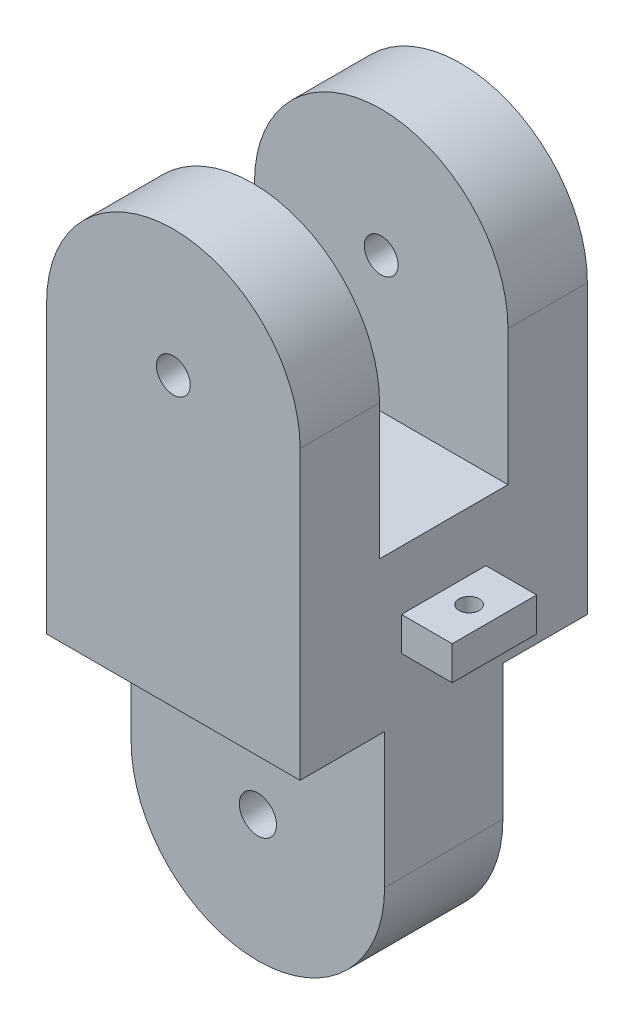
from build123d import *

# Parameters (mm, degrees)
LINK1_BODY_DEPTH       = 8.5
TONGUE_CUT_DEPTH       = 37.789944278
TONGUE_CUT_DEPTH_BACK  = 37.789944278
SKETCH1_W              = 5.5
SKETCH1_H              = 15.998130079
SLOT_CUT_DEPTH         = 35.420197559
SLOT_CUT_DEPTH_BACK    = 35.420197559
SKETCH2_W              = 7.6
SKETCH2_H              = 18
PIN_HOLES_DEPTH        = 35.420197559
PIN_HOLES_DEPTH_BACK   = 35.420197559
SKETCH3_R              = 1.1
SKETCH3_R_2            = 1
SKETCH4_W              = 3.5
SKETCH4_H              = 2
GUIDE_BLOCK_1_DEPTH    = 2.5
CORD_GUIDES_DEPTH      = 36.195880441
CORD_GUIDES_DEPTH_BACK = 36.195880441
SKETCH6_R              = 0.6


with BuildPart() as part:
    # Link1_Outline → Link1_Body (new, symmetric)
    with BuildSketch(Plane.XY):
        with BuildLine():
            Line((-7.5, 0), (-7.5, 25))
            ThreePointArc((-7.5, 25), (0, 32.5), (7.5, 25))
            Line((7.5, 25), (7.5, 0))
            ThreePointArc((7.5, 0), (0, -7.5), (-7.5, 0))
        make_face()
    extrude(amount=LINK1_BODY_DEPTH, both=True)

    # Sketch1 → Tongue_Cut (cut, two sides: drawn at the far end of the back side and taken through both)
    with BuildSketch(Plane(origin=(7.5, 0, 0), x_dir=(0, 0, -1), z_dir=(1, 0, 0)).offset(-TONGUE_CUT_DEPTH_BACK)):
        with Locations((6.25, -0.00093496)):
            Rectangle(SKETCH1_W, SKETCH1_H)
        with Locations((-6.25, -0.00093496)):
            Rectangle(SKETCH1_W, SKETCH1_H)
    extrude(amount=TONGUE_CUT_DEPTH + TONGUE_CUT_DEPTH_BACK, mode=Mode.SUBTRACT)

    # Sketch2 → Slot_Cut (cut, two sides: drawn at the far end of the back side and taken through both)
    with BuildSketch(Plane(origin=(0, 0, 0), x_dir=(0, 0, -1), z_dir=(1, 0, 0)).offset(-SLOT_CUT_DEPTH_BACK)):
        with Locations((0, 26)):
            Rectangle(SKETCH2_W, SKETCH2_H)
    extrude(amount=SLOT_CUT_DEPTH + SLOT_CUT_DEPTH_BACK, mode=Mode.SUBTRACT)

    # Sketch3 → Pin_Holes (cut, two sides: drawn at the far end of the back side and taken through both)
    with BuildSketch(Plane.XY.offset(-PIN_HOLES_DEPTH_BACK)):
        Circle(SKETCH3_R)
        with Locations((0, 25)):
            Circle(SKETCH3_R_2)
    extrude(amount=PIN_HOLES_DEPTH + PIN_HOLES_DEPTH_BACK, mode=Mode.SUBTRACT)

    # Sketch4 → Guide_Block_1 (add, symmetric)
    with BuildSketch(Plane.XY):
        with Locations((8.75, 12.5)):
            Rectangle(SKETCH4_W, SKETCH4_H)
    extrude(amount=GUIDE_BLOCK_1_DEPTH, both=True)

    # Sketch6 → Cord_Guides (cut, two sides: drawn at the far end of the back side and taken through both)
    with BuildSketch(Plane(origin=(0, 0, 0), x_dir=(1, 0, 0), z_dir=(0, 1, 0)).offset(-CORD_GUIDES_DEPTH_BACK)):
        with Locations((9, 0)):
            Circle(SKETCH6_R)
    extrude(amount=CORD_GUIDES_DEPTH + CORD_GUIDES_DEPTH_BACK, mode=Mode.SUBTRACT)


solid = part.part
